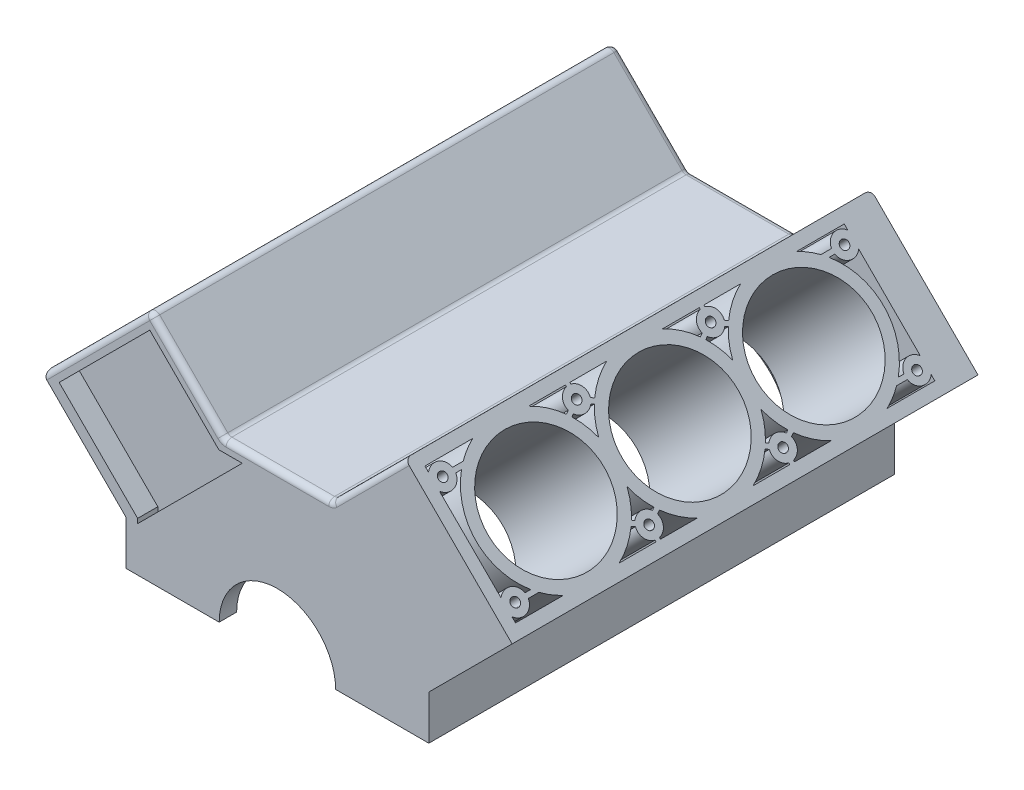
from build123d import *

# Parameters (mm, degrees)
Y_KSEKLIK_EKSTR_ZYON1_DEPTH = 241.3
IZIM2_R                     = 63.5
KES_EKSTR_ZYON1_DEPTH       = 370.174076489
IZIM3_R                     = 12.7
KES_EKSTR_ZYON3_DEPTH       = 120.65
FEDER1_START                = -120.65
FEDER1_DEPTH                = 120.65
FEDER2_REACH                = 371.174
FEDER3_START                = -120.65
FEDER3_DEPTH                = 120.65
FEDER4_REACH                = 371.174
FEDER5_REACH                = 371.174
IZIM8_WALLS_W               = 761.564221647
IZIM8_WALLS_H               = 5
FEDER6_REACH                = 371.174
IZIM9_WALLS_W               = 761.564221647
IZIM9_WALLS_H               = 5
IZIM10_R                    = 4.76
KES_EKSTR_ZYON4_DEPTH       = 76
G_VDE_TA_KOPYALA1_ANGLE     = 180
Y_KSEKLIK_EKSTR_ZYON2_START = 25.4
Y_KSEKLIK_EKSTR_ZYON2_DEPTH = 25.4
Y_KSEKLIK_EKSTR_ZYON3_START = 25.4
Y_KSEKLIK_EKSTR_ZYON3_DEPTH = 25.4
KES_EKSTR_ZYON5_DEPTH       = 22
DAIRESEL_KAPLAMA3_COUNT     = 2
KES_EKSTR_ZYON6_DEPTH       = 222.25
KES_EKSTR_ZYON6_DEPTH_BACK  = 247.65
RADYUS1_R                   = 6.35
RADYUS2_R                   = 6.35


# Read off the part's stored shape, not the designer's step: Feder1, Feder3
with BuildPart() as part:
    # Çizim1 → Yükseklik-Ekstrüzyon1 (new, symmetric)
    with BuildSketch(Plane.XY):
        with BuildLine():
            Line((63.5, 0), (165.1, 0))
            Line((165.1, 0), (165.1, 48.36))
            Line((165.1, 48.36), (255.934937111, 139.194937111))
            Line((255.934937111, 139.194937111), (139.191607537, 255.938266685))
            Line((139.191607537, 255.938266685), (58.615, 175.361659148))
            Line((58.615, 175.361659148), (0, 175.361659148))
            Line((0, 175.361659148), (0, 63.5))
            ThreePointArc((0, 63.5), (44.901280605, 44.901280605), (63.5, 0))
        make_face()
    extrude(amount=Y_KSEKLIK_EKSTR_ZYON1_DEPTH, both=True)

    # Çizim2 → Kes-Ekstrüzyon1 (cut, through all)
    with BuildSketch(Plane(origin=(197.564937111, 197.564937111, 0), x_dir=(0, 0, -1), z_dir=(0.7071067811865454, 0.7071067811865498, 0))):
        with Locations(Location((0, 0, 0), (0, 0, 90))):
            Circle(IZIM2_R)
        with Locations(Location((-146.05, 0, 0), (0, 0, 90))):
            Circle(IZIM2_R)
        with Locations(Location((146.05, 0, 0), (0, 0, 90))):
            Circle(IZIM2_R)
    extrude(amount=-KES_EKSTR_ZYON1_DEPTH, mode=Mode.SUBTRACT)

    # Çizim3 → Kes-Ekstrüzyon3 (cut)
    # profile 1 of 3: a face of its own
    with BuildSketch(Plane(origin=(197.564937111, 197.564937111, 0), x_dir=(0, 0, -1), z_dir=(0.7071067811865454, 0.7071067811865498, 0))):
        with BuildLine():
            Line((-176.498129495, 69.852354364), (-228.6, 69.852354364))
            Line((-228.6, 69.852354364), (-228.6, 64.276978837))
            ThreePointArc((-228.6, 64.276978837), (-214.584025044, 67.760535384), (-206.372106927, 55.88))
            ThreePointArc((-206.372106927, 55.88), (-214.584025044, 43.999464616), (-228.6, 47.483021163))
            Line((-228.6, 47.483021163), (-228.6, -47.483021163))
            ThreePointArc((-228.6, -47.483021163), (-214.584025044, -43.999464616), (-206.372106927, -55.88))
            ThreePointArc((-206.372106927, -55.88), (-214.584025044, -67.760535384), (-228.6, -64.276978837))
            Line((-228.6, -64.276978837), (-228.6, -69.847645636))
            Line((-228.6, -69.847645636), (-176.508929711, -69.847645636))
            ThreePointArc((-176.508929711, -69.847645636), (-222.249999772, 0.005891027), (-176.498129495, 69.852354364))
        make_face()
    # profile 2 of 3: a face of its own
    with BuildSketch(Plane(origin=(197.564937111, 197.564937111, 0), x_dir=(0, 0, -1), z_dir=(0.7071067811865454, 0.7071067811865498, 0))):
        with BuildLine():
            Line((-30.448129495, 69.852354364), (-115.601870505, 69.852354364))
            ThreePointArc((-115.601870505, 69.852354364), (-88.999762576, 50.514457434), (-73.025, 21.766703356))
            ThreePointArc((-73.025, 21.766703356), (-57.050237424, 50.514457434), (-30.448129495, 69.852354364))
        make_face()
        with Locations(Location((-73.027893073, 55.88, 0), (0, 0, 90))):
            Circle(IZIM3_R, mode=Mode.SUBTRACT)
    # profile 3 of 3: a face of its own
    with BuildSketch(Plane(origin=(197.564937111, 197.564937111, 0), x_dir=(0, 0, -1), z_dir=(0.7071067811865454, 0.7071067811865498, 0))):
        with BuildLine():
            ThreePointArc((-73.025, -21.766703356), (-88.995857471, -50.510046726), (-115.591070289, -69.847645636))
            Line((-115.591070289, -69.847645636), (-30.458929711, -69.847645636))
            ThreePointArc((-30.458929711, -69.847645636), (-57.054142529, -50.510046726), (-73.025, -21.766703356))
        make_face()
        with Locations(Location((-73.027893073, -55.88, 0), (0, 0, 90))):
            Circle(IZIM3_R, mode=Mode.SUBTRACT)
    kes_ekstr_zyon3 = extrude(amount=-KES_EKSTR_ZYON3_DEPTH, mode=Mode.SUBTRACT)

    # Feder1 outline → Feder1 (add)
    with BuildSketch(Plane(origin=(197.564937111, 197.564937111, 0), x_dir=(0, 0, -1), z_dir=(0.7071067811865454, 0.7071067811865498, 0)).offset(FEDER1_START)):
        with BuildLine():
            ThreePointArc((-85.254194794, -45.938111295), (-86.813646094, -47.932185177), (-88.438472998, -49.873359186))
            Line((-88.438472998, -49.873359186), (-85.062054346, -51.821803053))
            ThreePointArc((-85.062054346, -51.821803053), (-84.02773072, -49.532278225), (-82.562951285, -47.49115831))
            Line((-82.562951285, -47.49115831), (-85.254194794, -45.938111295))
        make_face()
        with BuildLine():
            ThreePointArc((-70.525314087, -68.330987849), (-73.025262564, -68.579999728), (-75.52531398, -68.332023483))
            Line((-75.52531398, -68.332023483), (-75.525000054, -69.847645636))
            Line((-75.525000054, -69.847645636), (-70.524999946, -69.847645636))
            Line((-70.524999946, -69.847645636), (-70.525314087, -68.330987849))
        make_face()
    feder1 = extrude(amount=FEDER1_DEPTH)

    # Çizim5 walls → Feder2 (add, up to next)
    with BuildSketch(Plane(origin=(197.564937111, 197.564937111, 0), x_dir=(0, 0, -1), z_dir=(0.7071067811865454, 0.7071067811865498, 0)), mode=Mode.PRIVATE) as feder2_sk1:
        Polygon((-392.358047135, -243.132101754), (262.585675077, 134.999832569), (260.085675077, 139.329959588), (-394.858047135, -238.801974735), align=None)
    feder2_tool1 = extrude(feder2_sk1.sketch, amount=-FEDER2_REACH, mode=Mode.PRIVATE) - part.part
    feder2 = feder2_tool1.solids().sort_by_distance((234.264536425, 160.865337798, 66.136186029))[0]
    add(feder2)

    # Feder3 outline → Feder3 (add)
    with BuildSketch(Plane(origin=(197.564937111, 197.564937111, 0), x_dir=(0, 0, -1), z_dir=(0.7071067811865454, 0.7071067811865498, 0)).offset(FEDER3_START)):
        with BuildLine():
            Line((-70.525314956, 68.330988024), (-70.524999946, 69.852354364))
            Line((-70.524999946, 69.852354364), (-75.525000054, 69.852354364))
            Line((-75.525000054, 69.852354364), (-75.525314849, 68.332023308))
            ThreePointArc((-75.525314849, 68.332023308), (-73.02526345, 68.579999728), (-70.525314956, 68.330988024))
        make_face()
        with BuildLine():
            Line((-85.254194134, 45.938110422), (-82.562950699, 47.491157644))
            ThreePointArc((-82.562950699, 47.491157644), (-84.027730277, 49.532277457), (-85.062054063, 51.821802213))
            Line((-85.062054063, 51.821802213), (-88.438472237, 49.873358307))
            ThreePointArc((-88.438472237, 49.873358307), (-86.813645384, 47.9321843), (-85.254194134, 45.938110422))
        make_face()
    feder3 = extrude(amount=FEDER3_DEPTH)

    # Çizim7 walls → Feder4 (add, up to next)
    with BuildSketch(Plane(origin=(197.564937111, 197.564937111, 0), x_dir=(0, 0, -1), z_dir=(0.7071067811865454, 0.7071067811865498, 0)), mode=Mode.PRIVATE) as feder4_sk1:
        Polygon((-394.858047135, 238.801974735), (260.085675077, -139.329959588), (262.585675077, -134.999832569), (-392.358047135, 243.132101754), align=None)
    feder4_tool1 = extrude(feder4_sk1.sketch, amount=-FEDER4_REACH, mode=Mode.PRIVATE) - part.part
    feder4 = feder4_tool1.solids().sort_by_distance((160.865337798, 234.264536425, 66.136186029))[0]
    add(feder4)

    # Çizim8 walls → Feder5 (add, up to next)
    with BuildSketch(Plane(origin=(197.564937111, 197.564937111, 0), x_dir=(0, 0, -1), z_dir=(0.7071067811865454, 0.7071067811865498, 0)), mode=Mode.PRIVATE) as feder5_sk1:
        with Locations((-208.464072593, -55.88)):
            Rectangle(IZIM8_WALLS_W, IZIM8_WALLS_H)
    feder5_tool1 = extrude(feder5_sk1.sketch, amount=-FEDER5_REACH, mode=Mode.PRIVATE) - part.part
    feder5 = feder5_tool1.solids().sort_by_distance((237.078064044, 158.051810179, 208.464072592))[0]
    add(feder5)

    # Çizim9 walls → Feder6 (add, up to next)
    with BuildSketch(Plane(origin=(197.564937111, 197.564937111, 0), x_dir=(0, 0, -1), z_dir=(0.7071067811865454, 0.7071067811865498, 0)), mode=Mode.PRIVATE) as feder6_sk1:
        with Locations((-208.464072593, 55.88)):
            Rectangle(IZIM9_WALLS_W, IZIM9_WALLS_H)
    feder6_tool1 = extrude(feder6_sk1.sketch, amount=-FEDER6_REACH, mode=Mode.PRIVATE) - part.part
    feder6 = feder6_tool1.solids().sort_by_distance((158.051810179, 237.078064044, 208.464072592))[0]
    add(feder6)

    # Aynalama1: Kes-Ekstrüzyon3, Feder1, Feder2, Feder3, Feder4, Feder5, Feder6 across plane
    add(kes_ekstr_zyon3.mirror(Plane.XY), mode=Mode.SUBTRACT)
    add(feder1.mirror(Plane.XY))
    add(feder2.mirror(Plane.XY))
    add(feder3.mirror(Plane.XY))
    add(feder4.mirror(Plane.XY))
    add(feder5.mirror(Plane.XY))
    add(feder6.mirror(Plane.XY))

    # Çizim10 → Kes-Ekstrüzyon4 (cut)
    with BuildSketch(Plane(origin=(197.564937111, 197.564937111, 0), x_dir=(0, 0, -1), z_dir=(0.7071067811865454, 0.7071067811865498, 0))):
        with Locations(Location((-219.072106927, -55.88, 0), (0, 0, 90))):
            Circle(IZIM10_R)
        with Locations(Location((-73.027893073, -55.88, 0), (0, 0, 90))):
            Circle(IZIM10_R)
        with Locations(Location((-73.027893073, 55.88, 0), (0, 0, 270))):
            Circle(IZIM10_R)
        with Locations(Location((-219.072106927, 55.88, 0), (0, 0, 270))):
            Circle(IZIM10_R)
    kes_ekstr_zyon4 = extrude(amount=-KES_EKSTR_ZYON4_DEPTH, mode=Mode.SUBTRACT)

    # Aynalama2: Kes-Ekstrüzyon4 across plane
    add(kes_ekstr_zyon4.mirror(Plane.XY), mode=Mode.SUBTRACT)


with BuildPart() as body_2:
    # Gövde-Taşı/Kopyala1: copy of part
    add(part.part.moved(Location((0, 0, 0))).rotate(Axis((0, 0, -12.7), (0, 1, 0)), G_VDE_TA_KOPYALA1_ANGLE))


with BuildPart() as part_1:
    add(part.part)

    add(body_2.part)  # Yükseklik-Ekstrüzyon2 merges body 2
    # Çizim14 → Yükseklik-Ekstrüzyon2 (add)
    with BuildSketch(Plane.XY.offset(215.9).offset(Y_KSEKLIK_EKSTR_ZYON2_START)):
        with BuildLine():
            Line((-165.1, 48.36), (-255.934937111, 139.194937111))
            Line((-255.934937111, 139.194937111), (-139.191607537, 255.938266685))
            Line((-139.191607537, 255.938266685), (-58.615, 175.361659148))
            Line((-58.615, 175.361659148), (0, 175.361659148))
            Line((0, 175.361659148), (0, 63.5))
            ThreePointArc((0, 63.5), (-44.901280605, 44.901280605), (-63.5, 0))
            Line((-63.5, 0), (-165.1, 0))
            Line((-165.1, 0), (-165.1, 48.36))
        make_face()
    extrude(amount=-Y_KSEKLIK_EKSTR_ZYON2_DEPTH)

    # Çizim15 → Yükseklik-Ekstrüzyon3 (add)
    with BuildSketch(Plane(origin=(0, 0, -241.3), x_dir=(-1, 0, 0), z_dir=(0, 0, -1)).offset(Y_KSEKLIK_EKSTR_ZYON3_START)):
        with BuildLine():
            Line((-58.615, 175.361659148), (-139.191607537, 255.938266685))
            Line((-139.191607537, 255.938266685), (-255.934937111, 139.194937111))
            Line((-255.934937111, 139.194937111), (-165.1, 48.36))
            Line((-165.1, 48.36), (-165.1, 0))
            Line((-165.1, 0), (-63.5, 0))
            ThreePointArc((-63.5, 0), (-44.901280605, 44.901280605), (0, 63.5))
            Line((0, 63.5), (0, 175.361659148))
            Line((0, 175.361659148), (-58.615, 175.361659148))
        make_face()
    extrude(amount=-Y_KSEKLIK_EKSTR_ZYON3_DEPTH)

    # Çizim16 → Kes-Ekstrüzyon5 (cut)
    with BuildSketch(Plane(origin=(0, 0, -266.7), x_dir=(-1, 0, 0), z_dir=(0, 0, -1))):
        Polygon((-63.875512242, 162.661659148), (-139.191607537, 237.977754443), (-237.974424869, 139.194937111), (-152.4, 53.620512242), (-152.4, 48.620512242), (-38.358853094, 162.661659148), align=None)
    kes_ekstr_zyon5 = extrude(amount=-KES_EKSTR_ZYON5_DEPTH, mode=Mode.SUBTRACT)

    # Dairesel Kaplama3: Kes-Ekstrüzyon5 ×2 about axis
    dairesel_kaplama3_axis = Axis((0, 0, -12.7), (0, 1, 0))
    for i in range(1, DAIRESEL_KAPLAMA3_COUNT):
        add(kes_ekstr_zyon5.rotate(dairesel_kaplama3_axis, i * 360 / DAIRESEL_KAPLAMA3_COUNT), mode=Mode.SUBTRACT)

    # Çizim17 → Kes-Ekstrüzyon6 (cut, two sides: drawn at the far end of the back side and taken through both)
    with BuildSketch(Plane.XY.offset(-KES_EKSTR_ZYON6_DEPTH_BACK)):
        Polygon((-146.05, 0), (-146.05, 28.26), (-18, 156.31), (18, 156.31), (146.05, 28.26), (146.05, 0), align=None)
    extrude(amount=KES_EKSTR_ZYON6_DEPTH + KES_EKSTR_ZYON6_DEPTH_BACK, mode=Mode.SUBTRACT)

    # Radyus1
    radyus1_edges = [part_1.edges().sort_by_distance(p)[0] for p in [
        (82.025, 92.285, -247.65),
        (0, 63.5, -247.65),
        (104.775, 0, -247.65),
        (-146.05, 0, -12.7),
        (-104.775, 0, -247.65),
        (-18, 156.31, -12.7),
        (-82.025, 92.285, -247.65),
        (146.05, 0, -12.7),
        (146.05, 14.13, -247.65),
        (18, 156.31, -12.7),
        (0, 156.31, -247.65),
        (-146.05, 14.13, -247.65),
    ]]
    fillet(radyus1_edges, radius=RADYUS1_R)

    # Radyus2
    radyus2_edges = [part_1.edges().sort_by_distance(p)[0] for p in [
        (58.615, 175.361659148, -12.7),
        (-58.615, 175.361659148, -12.7),
        (-139.191607537, 255.938266685, -12.7),
        (-255.934937111, 139.194937111, -12.7),
        (-98.903303769, 215.649962916, 241.3),
        (-197.563272324, 197.566601898, 241.3),
        (-197.563272324, 197.566601898, -266.7),
        (-98.903303769, 215.649962916, -266.7),
        (0, 175.361659148, -266.7),
        (98.903303769, 215.649962916, -266.7),
        (98.903303769, 215.649962916, 241.3),
        (0, 175.361659148, 241.3),
    ]]
    fillet(radyus2_edges, radius=RADYUS2_R)


solid = part_1.part
